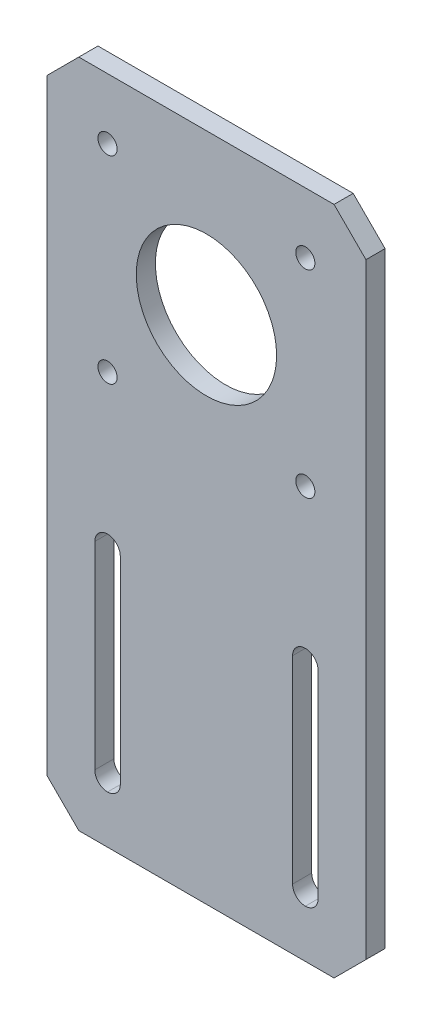
from build123d import *

# Parameters (mm, degrees)
SKETCH_1_R          = 1.5
SKETCH_1_W          = 4
SKETCH_1_H          = 35
EXTRUDE_1_DEPTH     = 3
FILLET_1_R          = 2
SKETCH_2_R          = 11
CUT_EXTRUDE_1_DEPTH = 3


with BuildPart() as part:
    # 草图1 → 凸台-拉伸1 (new body)
    with BuildSketch(Plane.XY):
        Polygon((-20, 25), (-25, 20), (-25, -75), (-20, -80), (20, -80), (25, -75), (25, 20), (20, 25), align=None)
        with Locations((-15.5, 15.5)):
            Circle(SKETCH_1_R, mode=Mode.SUBTRACT)
        with Locations((15.5, 15.5)):
            Circle(SKETCH_1_R, mode=Mode.SUBTRACT)
        with Locations((15.5, -15.5)):
            Circle(SKETCH_1_R, mode=Mode.SUBTRACT)
        with Locations((-15.5, -15.5)):
            Circle(SKETCH_1_R, mode=Mode.SUBTRACT)
        with Locations((-15.5, -55)):
            Rectangle(SKETCH_1_W, SKETCH_1_H, mode=Mode.SUBTRACT)
        with Locations((15.5, -55)):
            Rectangle(SKETCH_1_W, SKETCH_1_H, mode=Mode.SUBTRACT)
    extrude(amount=EXTRUDE_1_DEPTH)

    # 圆角1
    fillet_1_edges = [part.edges().sort_by_distance(p)[0] for p in [
        (17.5, -72.5, 1.5),
        (-13.5, -72.5, 1.5),
        (13.5, -37.5, 1.5),
        (-17.5, -37.5, 1.5),
        (-17.5, -72.5, 1.5),
        (13.5, -72.5, 1.5),
        (17.5, -37.5, 1.5),
        (-13.5, -37.5, 1.5),
    ]]
    fillet(fillet_1_edges, radius=FILLET_1_R - 0.0001)  # a hair under: the kernel refuses the full size

    # 草图2 → 切除-拉伸1 (cut)
    with BuildSketch(Plane.XY.offset(3)):
        Circle(SKETCH_2_R)
    extrude(amount=-CUT_EXTRUDE_1_DEPTH, mode=Mode.SUBTRACT)


solid = part.part
